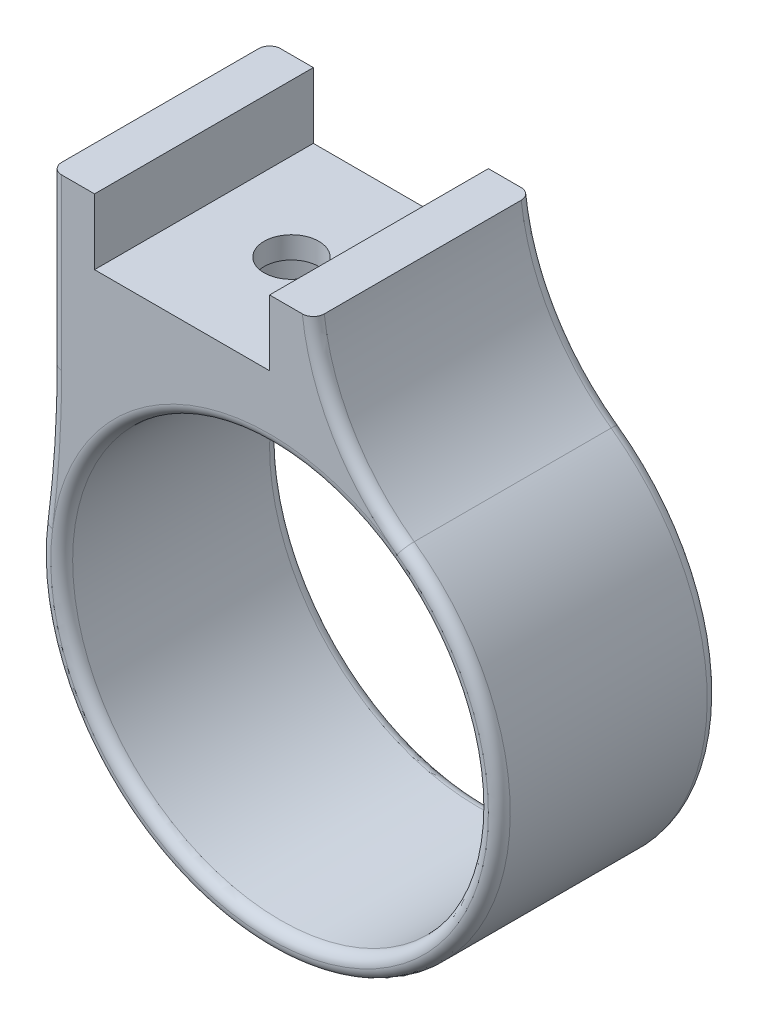
from build123d import *

# Parameters (mm, degrees)
SKETCH1_R              = 10.5
SKETCH1_R_2            = 9.5
BOSS_EXTRUDE1_DEPTH    = 10
FILLET1_R              = 50
FILLET2_R              = 10
M3_TAPPED_HOLE1_REACH  = 29.189
M3_TAPPED_HOLE1_BORE_R = 1.25
FILLET3_SIZE           = 0.5
CUT_EXTRUDE1_START     = 9
SKETCH4_R              = 2.75
SKETCH4_R_2            = 1.25
CUT_EXTRUDE1_DEPTH     = 9


with BuildPart() as part:
    # Sketch1 → Boss-Extrude1 (new body)
    # profile 1 of 2: a face of its own
    with BuildSketch(Plane.XY):
        with BuildLine():
            Line((-8, 15.5), (-10, 15.5))
            Line((-10, 15.5), (-10, 3.201562119))
            ThreePointArc((-10, 3.201562119), (-5.350189391, 9.034681703), (2, 10.307764064))
            Line((2, 10.307764064), (2, 15.5))
            Line((2, 15.5), (0, 15.5))
            Line((0, 15.5), (0, 12.5))
            Line((0, 12.5), (-8, 12.5))
            Line((-8, 12.5), (-8, 15.5))
        make_face()
    # profile 2 of 2: a face of its own
    with BuildSketch(Plane.XY):
        Circle(SKETCH1_R)
        Circle(SKETCH1_R_2, mode=Mode.SUBTRACT)
    extrude(amount=BOSS_EXTRUDE1_DEPTH)

    # Fillet1
    fillet1_edges = [part.edges().sort_by_distance(p)[0] for p in [
        (-10, 3.201562119, 5),
    ]]
    fillet(fillet1_edges, radius=FILLET1_R)

    # Fillet2
    # the kernel refuses this fillet: 10 mm, written as the material it adds along each edge
    with BuildSketch(Plane(origin=(2, 10.307764064, 0), x_dir=(0.9185397439209221, -0.39532864661909706, 0), z_dir=(0, 0, 1))) as fillet2_piece_1:
        with BuildLine():
            CenterArc((6.607059315, 9.770236435), FILLET2_R, 210.006360565, 47.687742379)
            Line((-2.052639605, 4.769275067), (-2.225833584, 4.66925584))
            ThreePointArc((-2.225833584, 4.66925584), (-1.210027752, 2.305571804), (-0.183707949, -0.079065729))
            Line((-0.183707949, -0.079065729), (0.042626189, -0.195404729))
            ThreePointArc((0.042626189, -0.195404729), (2.237874929, 0.041251743), (4.433123669, -0.195404729))
            Line((4.433123669, -0.195404729), (4.475749859, 0))
        make_face()
    extrude(amount=10)

    # M3 Tapped Hole1 bore → M3 Tapped Hole1 (cut, up to next)
    with BuildSketch(Plane(origin=(0, 12.5, 0), x_dir=(1, 0, 0), z_dir=(0, 1, 0)), mode=Mode.PRIVATE) as m3_tapped_hole1_sk1:
        with Locations((-4, -5)):
            Circle(M3_TAPPED_HOLE1_BORE_R)
    m3_tapped_hole1_tool1 = extrude(m3_tapped_hole1_sk1.sketch, amount=-M3_TAPPED_HOLE1_REACH, mode=Mode.PRIVATE) & part.part
    add(m3_tapped_hole1_tool1.solids().sort_by_distance((-4, 12.5, 5))[0], mode=Mode.SUBTRACT)

    # Fillet3
    # a fillet whose section is not a circle: 0.5 mm, written as the material it takes off along each edge
    with BuildSketch(Plane(origin=(0, 0, 0), x_dir=(1, 0, 0), z_dir=(0, -1, 0))) as fillet3_piece_1:
        with BuildLine():
            Bezier((9.5 + FILLET3_SIZE, 0), (9.5, 0), (9.5, FILLET3_SIZE), weights=[1, 0.707106781, 1])
            Line((9.5, FILLET3_SIZE), (9.5, 0))
            Line((9.5, 0), (9.5 + FILLET3_SIZE, 0))
        make_face()
    revolve(axis=Axis((0, 0, 0), (0, 0, 1)), mode=Mode.SUBTRACT)
    with BuildSketch(Plane(origin=(-10, 16.75, 0), x_dir=(1, 0, 0), z_dir=(0, -1, 0))) as fillet3_piece_2:
        with BuildLine():
            Bezier((FILLET3_SIZE, 0), (0, 0), (0, FILLET3_SIZE), weights=[1, 0.707106781, 1])
            Line((0, FILLET3_SIZE), (0, 0))
            Line((0, 0), (FILLET3_SIZE, 0))
        make_face()
    extrude(amount=8.987912652, mode=Mode.SUBTRACT)
    with BuildSketch(Plane(origin=(0, 0, 0), x_dir=(-0.9917355371900827, 0.12829896443190072, 0), z_dir=(0.12829896443190072, 0.9917355371900827, 0))) as fillet3_piece_3:
        with BuildLine():
            Bezier((10.5, FILLET3_SIZE), (10.5, 0), (10.5 - FILLET3_SIZE, 0), weights=[1, 0.707106781, 1])
            Line((10.5 - FILLET3_SIZE, 0), (10.5, 0))
            Line((10.5, 0), (10.5, FILLET3_SIZE))
        make_face()
    revolve(axis=Axis((0, 0, 0), (0, 0, 1)), revolution_arc=241.77893748, mode=Mode.SUBTRACT)
    with BuildSketch(Plane(origin=(0, 0, 10), x_dir=(0.5820146789437495, 0.8131782790348032, 0), z_dir=(-0.8131782790348032, 0.5820146789437495, 0))) as fillet3_piece_4:
        with BuildLine():
            Bezier((10.5, FILLET3_SIZE), (10.5, 0), (10.5 - FILLET3_SIZE, 0), weights=[1, 0.707106781, 1])
            Line((10.5 - FILLET3_SIZE, 0), (10.5, 0))
            Line((10.5, 0), (10.5, FILLET3_SIZE))
        make_face()
    revolve(axis=Axis((0, 0, 10), (0, 0, -1)), revolution_arc=241.77893748, mode=Mode.SUBTRACT)
    with BuildSketch(Plane(origin=(-60, 7.762087348, 0), x_dir=(0.9917355371900826, -0.1282989644319008, 0), z_dir=(-0.1282989644319008, -0.9917355371900826, 0))) as fillet3_piece_5:
        with BuildLine():
            Bezier((50 + FILLET3_SIZE, 0), (50, 0), (50, FILLET3_SIZE), weights=[1, 0.707106781, 1])
            Line((50, FILLET3_SIZE), (50, 0))
            Line((50, 0), (50 + FILLET3_SIZE, 0))
        make_face()
    revolve(axis=Axis((-60, 7.762087348, 0), (0, 0, 1)), revolution_arc=7.371307019, mode=Mode.SUBTRACT)
    with BuildSketch(Plane(origin=(-60, 7.762087348, 10), x_dir=(0.9917355371900826, -0.1282989644319008, 0), z_dir=(-0.1282989644319008, -0.9917355371900826, 0))) as fillet3_piece_6:
        with BuildLine():
            Bezier((50 + FILLET3_SIZE, 0), (50, 0), (50, -FILLET3_SIZE), weights=[1, 0.707106781, 1])
            Line((50, -FILLET3_SIZE), (50, 0))
            Line((50, 0), (50 + FILLET3_SIZE, 0))
        make_face()
    revolve(axis=Axis((-60, 7.762087348, 10), (0, 0, 1)), revolution_arc=7.371307019, mode=Mode.SUBTRACT)
    with BuildSketch(Plane(origin=(11.931300918, 16.67015472, 0), x_dir=(-0.999970124297953, 0.0077298455053398385, 0), z_dir=(0.0077298455053398385, 0.999970124297953, 0))) as fillet3_piece_7:
        with BuildLine():
            Bezier((10, FILLET3_SIZE), (10, 0), (10 + FILLET3_SIZE, 0), weights=[1, 0.707106781, 1])
            Line((10 + FILLET3_SIZE, 0), (10, 0))
            Line((10, 0), (10, FILLET3_SIZE))
        make_face()
    revolve(axis=Axis((11.931300918, 16.67015472, 0), (0, 0, 1)), revolution_arc=54.850522395, mode=Mode.SUBTRACT)
    with BuildSketch(Plane(origin=(11.931300918, 16.67015472, 10), x_dir=(-0.999970124297953, 0.0077298455053398385, 0), z_dir=(0.0077298455053398385, 0.999970124297953, 0))) as fillet3_piece_8:
        with BuildLine():
            Bezier((10, -FILLET3_SIZE), (10, 0), (10 + FILLET3_SIZE, 0), weights=[1, 0.707106781, 1])
            Line((10 + FILLET3_SIZE, 0), (10, 0))
            Line((10, 0), (10, -FILLET3_SIZE))
        make_face()
    revolve(axis=Axis((11.931300918, 16.67015472, 10), (0, 0, 1)), revolution_arc=54.850522395, mode=Mode.SUBTRACT)
    with BuildSketch(Plane(origin=(0, 0, 10), x_dir=(1, 0, 0), z_dir=(0, -1, 0))) as fillet3_piece_9:
        with BuildLine():
            Bezier((9.5 + FILLET3_SIZE, 0), (9.5, 0), (9.5, -FILLET3_SIZE), weights=[1, 0.707106781, 1])
            Line((9.5, -FILLET3_SIZE), (9.5, 0))
            Line((9.5, 0), (9.5 + FILLET3_SIZE, 0))
        make_face()
    revolve(axis=Axis((0, 0, 10), (0, 0, 1)), mode=Mode.SUBTRACT)
    with BuildSketch(Plane(origin=(-10, 16.75, 10), x_dir=(1, 0, 0), z_dir=(0, -1, 0))) as fillet3_piece_10:
        with BuildLine():
            Bezier((FILLET3_SIZE, 0), (0, 0), (0, -FILLET3_SIZE), weights=[1, 0.707106781, 1])
            Line((0, -FILLET3_SIZE), (0, 0))
            Line((0, 0), (FILLET3_SIZE, 0))
        make_face()
    extrude(amount=8.987912652, mode=Mode.SUBTRACT)

    # Sketch4 → Cut-Extrude1 (cut)
    with BuildSketch(Plane(origin=(0, 2.5, 0), x_dir=(1, 0, 0), z_dir=(0, 1, 0)).offset(CUT_EXTRUDE1_START)):
        with Locations((-4, -5)):
            Circle(SKETCH4_R)
        with Locations(Location((-4, -5, 0), (0, 0, 270))):
            Circle(SKETCH4_R_2, mode=Mode.SUBTRACT)
    extrude(amount=-CUT_EXTRUDE1_DEPTH, mode=Mode.SUBTRACT)


solid = part.part
